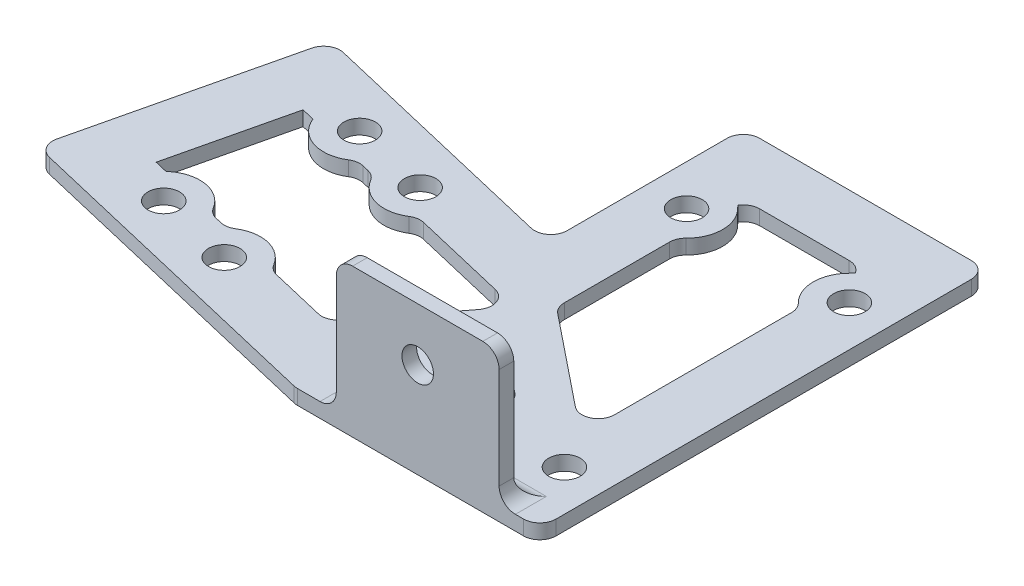
from build123d import *

# Parameters (mm, degrees)
BOSS_EXTRUDE1_DEPTH          = 2.286
SKETCH2_W                    = 25.4
SKETCH2_H                    = 2.286
BOSS_EXTRUDE2_DEPTH          = 20.828
F_10_0_1935_DIAMETER_HOLE1_D = 4.9149
F_10_0_1935_DIAMETER_HOLE2_D = 4.9149
F_10_0_1935_DIAMETER_HOLE3_D = 4.9149
CUT_EXTRUDE1_DEPTH           = 50.8
FILLET1_R                    = 2.54
FILLET2_R                    = 2.54


with BuildPart() as part:
    # Sketch1 → Boss-Extrude1 (new body)
    with BuildSketch(Plane(origin=(0, 0, 0), x_dir=(1, 0, 0), z_dir=(0, 1, 0))):
        Polygon((19.05, 34.925), (-19.05, 34.925), (-19.05, 4.22504843), (-63.051024839, 14.626449943), (-71.815919826, -22.451665109), (-19.05, -34.925), (19.05, -34.925), align=None)
    extrude(amount=BOSS_EXTRUDE1_DEPTH)

    # Sketch2 → Boss-Extrude2 (add)
    with BuildSketch(Plane(origin=(0, 2.286, 0), x_dir=(1, 0, 0), z_dir=(0, 1, 0))):
        with Locations((0, -33.782)):
            Rectangle(SKETCH2_W, SKETCH2_H)
    extrude(amount=BOSS_EXTRUDE2_DEPTH)

    # #10 (0.1935) Diameter Hole1 (through all)
    with Locations(Plane(origin=(0, 2.286, 0), x_dir=(1, 0, 0), z_dir=(0, 1, 0))):
        with Locations((-12.7, -24.735), (12.7, -24.735), (-12.7, 19.715), (12.7, 19.715)):
            Hole(F_10_0_1935_DIAMETER_HOLE1_D / 2)

    # #10 (0.1935) Diameter Hole2 (through all)
    with Locations(Plane(origin=(0, 0, 32.639), x_dir=(-1, 0, 0), z_dir=(0, 0, -1))):
        with Locations((0, 14.859)):
            Hole(F_10_0_1935_DIAMETER_HOLE2_D / 2)

    # #10 (0.1935) Diameter Hole3 (through all)
    with Locations(Plane(origin=(0, 2.286, 0), x_dir=(1, 0, 0), z_dir=(0, 1, 0))):
        with Locations((-48.685323349, 4.705533941), (-36.325951665, 1.783902278), (-54.528586674, -20.013209428), (-42.169214989, -22.93484109)):
            Hole(F_10_0_1935_DIAMETER_HOLE3_D / 2)

    # Sketch10 → Cut-Extrude1 (cut)
    with BuildSketch(Plane(origin=(0, 2.286, 0), x_dir=(1, 0, 0), z_dir=(0, 1, 0))):
        with BuildLine():
            Line((-9.525, -3.741848106), (9.525, -19.04176984))
            Line((9.525, -19.04176984), (9.525, 15.062702933))
            ThreePointArc((9.525, 15.062702933), (7.06755, 19.715), (9.525, 24.367297067))
            Line((9.525, 24.367297067), (9.525, 25.4))
            Line((9.525, 25.4), (-9.525, 25.4))
            Line((-9.525, 25.4), (-9.525, 24.367297067))
            ThreePointArc((-9.525, 24.367297067), (-7.06755, 19.715), (-9.525, 15.062702933))
            Line((-9.525, 15.062702933), (-9.525, -3.741848106))
        make_face()
        with BuildLine():
            Line((-7.305850206, -23.114), (4.454648276, -23.114))
            Line((4.454648276, -23.114), (-8.982344597, -12.322139669))
            Line((-8.982344597, -12.322139669), (-14.383129392, -19.359912238))
            ThreePointArc((-14.383129392, -19.359912238), (-10.060641775, -19.759230596), (-7.305850206, -23.114))
        make_face()
        with BuildLine():
            Line((-25.627859788, -23.582547729), (-12.912609208, -7.013281383))
            Line((-12.912609208, -7.013281383), (-32.528842365, -2.37620036))
            ThreePointArc((-32.528842365, -2.37620036), (-37.621695307, -3.697479064), (-41.583876796, -0.235680925))
            Line((-41.583876796, -0.235680925), (-44.888214049, 0.545431302))
            ThreePointArc((-44.888214049, 0.545431302), (-49.981066991, -0.775847401), (-53.94324848, 2.685950737))
            Line((-53.94324848, 2.685950737), (-55.972719823, 3.165697433))
            Line((-55.972719823, 3.165697433), (-60.355167316, -15.373360093))
            Line((-60.355167316, -15.373360093), (-58.325695974, -15.853106789))
            ThreePointArc((-58.325695974, -15.853106789), (-53.232843031, -14.531828086), (-49.270661542, -17.993626224))
            Line((-49.270661542, -17.993626224), (-45.96632429, -18.774738451))
            ThreePointArc((-45.96632429, -18.774738451), (-40.873471347, -17.453459748), (-36.911289858, -20.915257887))
            Line((-36.911289858, -20.915257887), (-25.627859788, -23.582547729))
        make_face()
    extrude(amount=-CUT_EXTRUDE1_DEPTH, mode=Mode.SUBTRACT)

    # Fillet1
    # the kernel refuses this fillet: 2.54 mm, written as the material it adds along each edge
    with BuildSketch(Plane(origin=(-19.05, 0, -4.22504843), x_dir=(0, 0, -1), z_dir=(0, 1, 0))) as fillet1_piece_1:
        with BuildLine():
            CenterArc((FILLET1_R * 1.26395030924, FILLET1_R), FILLET1_R, 166.7, 103.3)
            Line((FILLET1_R * 0.290771436458, FILLET1_R * 1.23004973719), (0, 0))
            Line((0, 0), (FILLET1_R * 1.26395030924, 0))
        make_face()
    extrude(amount=2.286)
    with BuildSketch(Plane(origin=(9.525, 2.286, -24.367297067), x_dir=(-0.773382110639457, 0, 0.6339401477607004), z_dir=(0, -1, 0)), Plane(origin=(-41.583876796, 2.286, 0.235680925), x_dir=(0.4390208071072497, 0, 0.8984768950434391), z_dir=(0, -1, 0)), Plane(origin=(-36.911289858, 2.286, 20.915257887), x_dir=(-0.43902080710723695, 0, -0.8984768950434453), z_dir=(0, -1, 0))) as fillet1_piece_2:
        with BuildLine():
            CenterArc((1.21025793, 2.5302202), FILLET1_R, 219.341421459, 45.629074101)
            Line((-0.754132631, 0.920012225), (0, 0))
            ThreePointArc((0, 0), (0.493789689, 0.021686706), (0.987579378, 0))
        make_face()
    extrude(amount=2.286)
    with BuildSketch(Plane(origin=(9.525, 2.286, -15.062702933), x_dir=(0, 0, 1), z_dir=(0, -1, 0)), Plane(origin=(-9.525, 2.286, -24.367297067), x_dir=(0, 0, -1), z_dir=(0, -1, 0)), Plane(origin=(-32.528842365, 2.286, 2.37620036), x_dir=(0.9731788727770777, 0, 0.23004973718814892), z_dir=(0, -1, 0)), Plane(origin=(-45.96632429, 2.286, 18.774738451), x_dir=(-0.9731788727770783, 0, -0.23004973718814611), z_dir=(0, -1, 0)), Plane(origin=(-44.888214049, 2.286, -0.545431302), x_dir=(0.9731788727770778, 0, 0.2300497371881489), z_dir=(0, -1, 0))) as fillet1_piece_3:
        with BuildLine():
            CenterArc((1.189595948, 2.54), FILLET1_R, 224.370925899, 45.629074101)
            ThreePointArc((-0.626066217, 0.763776224), (-0.296260998, 0.395636185), (0, 0))
            Line((0, 0), (1.189595948, 0))
        make_face()
    extrude(amount=2.286)
    with BuildSketch(Plane(origin=(9.525, 2.286, 19.04176984), x_dir=(-0.7796710587119345, 0, -0.6261893006168431), z_dir=(0, -1, 0))) as fillet1_piece_4:
        with BuildLine():
            CenterArc((FILLET1_R * 2.08573767417, FILLET1_R), FILLET1_R, 141.230467708, 128.769532292)
            Line((FILLET1_R * 1.30606661546, FILLET1_R * 1.62618930062), (0, 0))
            Line((0, 0), (FILLET1_R * 2.08573767417, 0))
        make_face()
    extrude(amount=2.286)
    with BuildSketch(Plane(origin=(-9.525, 2.286, 3.741848106), x_dir=(0, 0, -1), z_dir=(0, -1, 0))) as fillet1_piece_5:
        with BuildLine():
            CenterArc((FILLET1_R * 0.47944667845, FILLET1_R), FILLET1_R, 218.769532292, 51.230467708)
            Line((-FILLET1_R * 0.300224380262, FILLET1_R * 0.373810699383), (0, 0))
            Line((0, 0), (FILLET1_R * 0.47944667845, 0))
        make_face()
    extrude(amount=2.286)
    with BuildSketch(Plane(origin=(-9.525, 2.286, -15.062702933), x_dir=(0, 0, 1), z_dir=(0, -1, 0)), Plane(origin=(-49.270661542, 2.286, 17.993626224), x_dir=(0.9731788727770844, 0, 0.23004973718812088), z_dir=(0, -1, 0))) as fillet1_piece_6:
        with BuildLine():
            CenterArc((1.189595948, -2.54), FILLET1_R, 90, 45.629074101)
            ThreePointArc((-0.626066217, -0.763776224), (-0.296260998, -0.395636185), (0, 0))
            Line((0, 0), (1.189595948, 0))
        make_face()
    extrude(amount=2.286)
    with BuildSketch(Plane(origin=(-9.525, 2.286, -25.4), x_dir=(1, 0, 0), z_dir=(0, -1, 0)), Plane(origin=(9.525, 2.286, -25.4), x_dir=(0, 0, 1), z_dir=(0, -1, 0))) as fillet1_piece_7:
        with BuildLine():
            CenterArc((FILLET1_R, FILLET1_R), FILLET1_R, 180, 90)
            Line((0, FILLET1_R), (0, 0))
            Line((0, 0), (FILLET1_R, 0))
        make_face()
    extrude(amount=2.286)
    with BuildSketch(Plane(origin=(-7.305850206, 2.286, 23.114), x_dir=(1, 0, 0), z_dir=(0, -1, 0))) as fillet1_piece_8:
        with BuildLine():
            CenterArc((1.639698228, -2.54), FILLET1_R, 90, 59.392795524)
            ThreePointArc((-0.546423923, -1.246759907), (-0.235408974, -0.639948065), (0, 0))
            Line((0, 0), (1.639698228, 0))
        make_face()
    extrude(amount=2.286)
    with BuildSketch(Plane(origin=(-14.383129392, 2.286, 19.359912238), x_dir=(0.6087977522043749, 0, -0.7933254672017661), z_dir=(0, -1, 0))) as fillet1_piece_9:
        with BuildLine():
            CenterArc((4.66706616, 2.54), FILLET1_R, 165.34503033, 104.65496967)
            ThreePointArc((2.209700261, 3.182614066), (1.387122014, 1.395324661), (0, 0))
            Line((0, 0), (4.66706616, 0))
        make_face()
    extrude(amount=2.286)
    with BuildSketch(Plane(origin=(-8.982344597, 2.286, 12.322139669), x_dir=(0.7796710587119348, 0, 0.6261893006168427), z_dir=(0, -1, 0))) as fillet1_piece_10:
        with BuildLine():
            CenterArc((FILLET1_R * 1.02235985184, FILLET1_R), FILLET1_R, 178.733091006, 91.266908994)
            Line((FILLET1_R * 0.0226043062578, FILLET1_R * 1.02210993147), (0, 0))
            Line((0, 0), (FILLET1_R * 1.02235985184, 0))
        make_face()
    extrude(amount=2.286)
    with BuildSketch(Plane(origin=(4.454648276, 2.286, 23.114), x_dir=(-1, 0, 0), z_dir=(0, -1, 0))) as fillet1_piece_11:
        with BuildLine():
            CenterArc((FILLET1_R * 2.84206558138, FILLET1_R), FILLET1_R, 128.769532292, 141.230467708)
            Line((FILLET1_R * 2.21587628076, FILLET1_R * 1.77967105871), (0, 0))
            Line((0, 0), (FILLET1_R * 2.84206558138, 0))
        make_face()
    extrude(amount=2.286)
    with BuildSketch(Plane(origin=(-12.912609208, 2.286, 7.013281383), x_dir=(-0.6087977522043783, 0, 0.7933254672017636), z_dir=(0, -1, 0))) as fillet1_piece_12:
        with BuildLine():
            CenterArc((FILLET1_R * 1.54584224651, FILLET1_R), FILLET1_R, 155.797376702, 114.202623298)
            Line((FILLET1_R * 0.633740899703, FILLET1_R * 1.40996479501), (0, 0))
            Line((0, 0), (FILLET1_R * 1.54584224651, 0))
        make_face()
    extrude(amount=2.286)
    with BuildSketch(Plane(origin=(-25.627859788, 2.286, 23.582547729), x_dir=(-0.9731788727770897, 0, -0.2300497371880981), z_dir=(0, -1, 0))) as fillet1_piece_13:
        with BuildLine():
            CenterArc((FILLET1_R * 0.646896539576, FILLET1_R), FILLET1_R, 204.202623298, 65.797376702)
            Line((-FILLET1_R * 0.265204807237, FILLET1_R * 0.590035204995), (0, 0))
            Line((0, 0), (FILLET1_R * 0.646896539576, 0))
        make_face()
    extrude(amount=2.286)
    # the kernel refuses this fillet: 2.54 mm, written as the material it takes off along each edge
    with BuildSketch(Plane(origin=(-63.051024839, -6.35, -14.626449943), x_dir=(-0.23004973718809857, 0, 0.9731788727770896), z_dir=(0, 1, 0)), Plane(origin=(19.05, -6.35, -34.925), x_dir=(-1, 0, 0), z_dir=(0, 1, 0)), Plane(origin=(19.05, -6.35, 34.925), x_dir=(0, 0, -1), z_dir=(0, 1, 0)), Plane(origin=(-71.815919826, -6.35, 22.451665109), x_dir=(0.9731788727770898, 0, 0.23004973718809796), z_dir=(0, 1, 0))) as fillet1_2_piece_1:
        with BuildLine():
            CenterArc((FILLET1_R, FILLET1_R), FILLET1_R, 180, 90)
            Line((0, FILLET1_R), (0, 0))
            Line((0, 0), (FILLET1_R, 0))
        make_face()
    extrude(amount=14.986, mode=Mode.SUBTRACT)
    with BuildSketch(Plane(origin=(-19.05, -6.35, -34.925), x_dir=(1, 0, 0), z_dir=(0, 1, 0))) as fillet1_2_piece_2:
        with BuildLine():
            CenterArc((FILLET1_R, -FILLET1_R), FILLET1_R, 90, 90)
            Line((0, -FILLET1_R), (0, 0))
            Line((0, 0), (FILLET1_R, 0))
        make_face()
    extrude(amount=14.986, mode=Mode.SUBTRACT)
    with BuildSketch(Plane(origin=(-19.05, -0.740336242, 34.925), x_dir=(1, 0, 0), z_dir=(0, 1, 0))) as fillet1_2_piece_3:
        with BuildLine():
            CenterArc((FILLET1_R * 0.116588384541, FILLET1_R), FILLET1_R, 256.7, 13.3)
            Line((-FILLET1_R * 0.113461352647, FILLET1_R * 0.0268211272229), (0, 0))
            Line((0, 0), (FILLET1_R * 0.116588384541, 0))
        make_face()
    extrude(amount=3.766672484, mode=Mode.SUBTRACT)

    # Fillet2
    fillet2_edges = [part.edges().sort_by_distance(p)[0] for p in [
        (12.7, 2.286, 33.782),
        (0, 2.286, 32.639),
        (-12.7, 2.286, 33.782),
        (12.7, 23.114, 33.782),
        (-12.7, 23.114, 33.782),
    ]]
    fillet(fillet2_edges, radius=FILLET2_R)


solid = part.part
